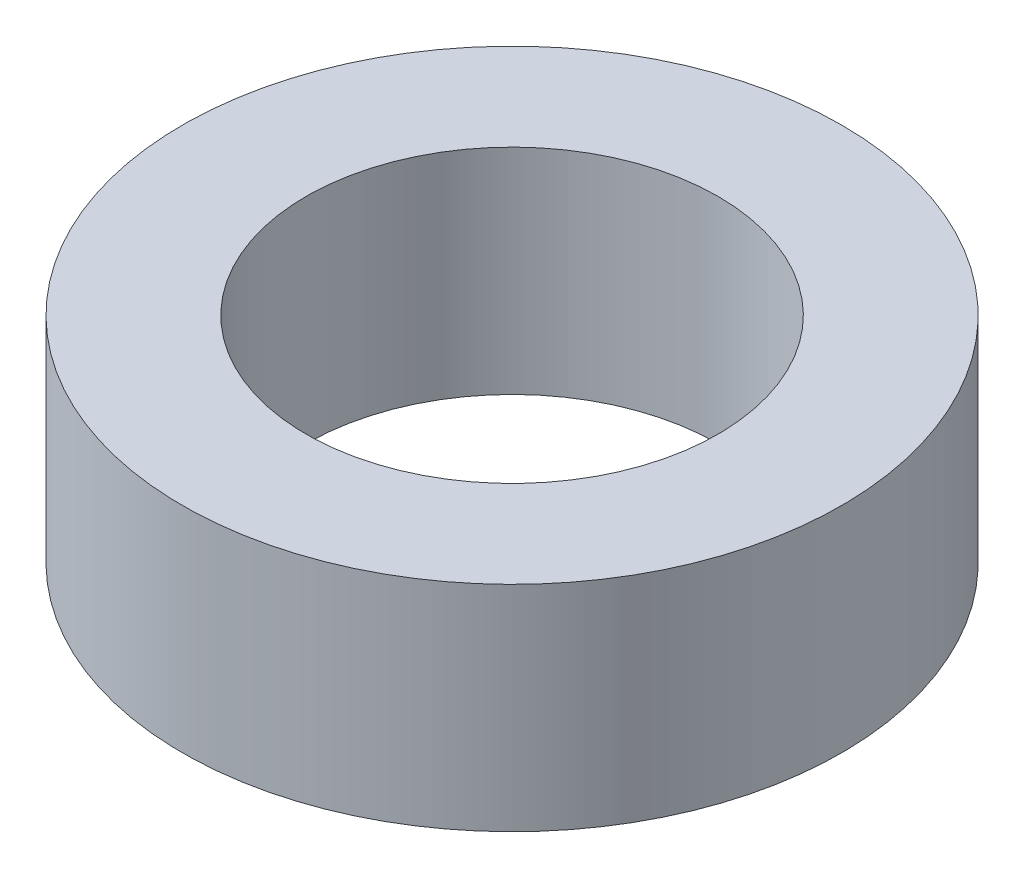
from build123d import *

# Parameters (mm, degrees)
SKETCH1_R           = 20
BOSS_EXTRUDE1_DEPTH = 13
SKETCH2_R           = 12.5
CUT_EXTRUDE1_DEPTH  = 32.128764833


with BuildPart() as part:
    # Sketch1 → Boss-Extrude1 (new body)
    with BuildSketch(Plane(origin=(0, 0, 0), x_dir=(1, 0, 0), z_dir=(0, 1, 0))):
        Circle(SKETCH1_R)
    extrude(amount=BOSS_EXTRUDE1_DEPTH)

    # Sketch2 → Cut-Extrude1 (cut, through all)
    with BuildSketch(Plane(origin=(0, 0, 0), x_dir=(1, 0, 0), z_dir=(0, 1, 0))):
        Circle(SKETCH2_R)
    extrude(amount=CUT_EXTRUDE1_DEPTH, mode=Mode.SUBTRACT)


solid = part.part
